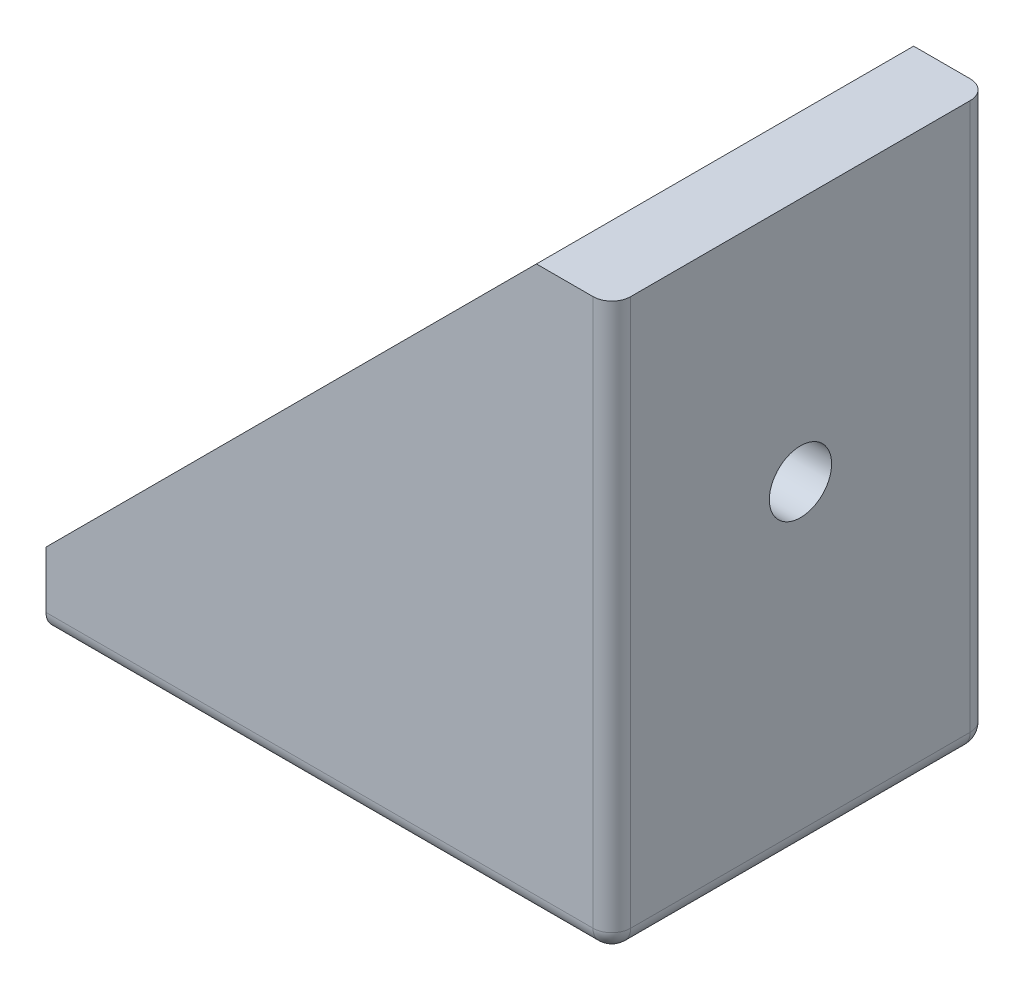
from build123d import *

# Parameters (mm, degrees)
EXTRUDE_3_DEPTH    = 10
SHELL_START        = -30
SHELL_1_OUTLINE_W  = 27
SHELL_1_OUTLINE_H  = 12
SHELL_1_DEPTH      = 26
HOLE_WIZARD_M4_2_D = 3.3
HOLE_WIZARD_M4_3_D = 3.3
FILLET_2_R         = 1
FILLET_3_R         = 1


# Read off the part's stored shape, not the designer's step: 薄殼1
with BuildPart() as part:
    # 草圖8 → 填料-伸長3 (new, symmetric)
    with BuildSketch(Plane.XY):
        Polygon((-4, 30), (-30, 4), (-30, 0), (0, 0), (0, 30), align=None)
    extrude(amount=EXTRUDE_3_DEPTH, both=True)

    # 薄殼1 outline → 薄殼1 (cut)
    with BuildSketch(Plane.YZ.offset(SHELL_START)):
        with Locations((17.5, 0)):
            Rectangle(SHELL_1_OUTLINE_W, SHELL_1_OUTLINE_H)
    extrude(amount=SHELL_1_DEPTH, mode=Mode.SUBTRACT)

    # M4 螺紋孔2 (through all)
    with Locations(Plane(origin=(0, 4, 0), x_dir=(-1, 0, 0), z_dir=(0, 1, 0))):
        with Locations((17, 0)):
            Hole(HOLE_WIZARD_M4_2_D / 2)

    # M4 螺紋孔3 (through all)
    with Locations(Plane(origin=(-4, 0, 0), x_dir=(0, -1, 0), z_dir=(-1, 0, 0))):
        with Locations((-17, 0)):
            Hole(HOLE_WIZARD_M4_3_D / 2)

    # 圓角2
    fillet_2_edges = [part.edges().sort_by_distance(p)[0] for p in [
        (-4, 17, -6),
        (-4, 17, 6),
        (0, 0, 0),
    ]]
    fillet(fillet_2_edges, radius=FILLET_2_R)

    # 圓角3
    fillet_3_edges = [part.edges().sort_by_distance(p)[0] for p in [
        (-15.5, 0, 10),
        (-17.5, 4, -6),
        (-17.5, 4, 6),
        (-4, 4, 0),
        (-4.292893219, 4, -5.707106781),
        (-4.292893219, 4, 5.707106781),
        (0, 15.5, -10),
        (0, 15.5, 10),
        (-0.292893219, 0.292893219, -10),
        (-0.292893219, 0.292893219, 10),
        (-15.5, 0, -10),
    ]]
    fillet(fillet_3_edges, radius=FILLET_3_R)


solid = part.part
